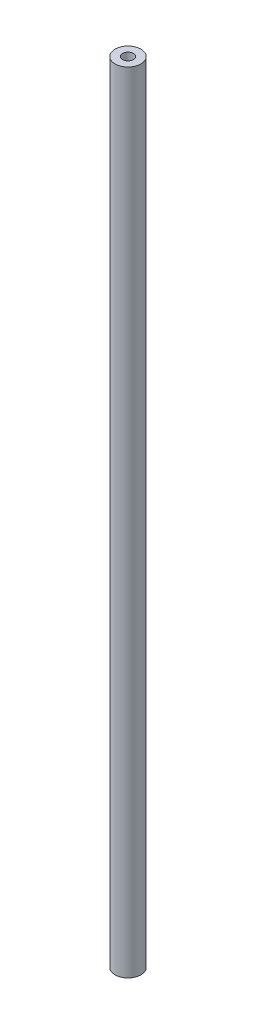
from build123d import *

# Parameters (mm, degrees)
SZKIC1_R                    = 5
DODANIE_WYCI_GNI_CIE1_DEPTH = 306
TAP_DRILL_FOR_M5_TAP1_D     = 4.2
TAP_DRILL_FOR_M5_TAP1_DEPTH = 30
TAP_DRILL_FOR_M5_TAP1_TIP   = 1.2618073
TAP_DRILL_FOR_M5_TAP2_D     = 4.2
TAP_DRILL_FOR_M5_TAP2_DEPTH = 30
TAP_DRILL_FOR_M5_TAP2_TIP   = 1.2618073


with BuildPart() as part:
    # Szkic1 → Dodanie-wyciągnięcie1 (new body)
    with BuildSketch(Plane(origin=(0, 0, 0), x_dir=(1, 0, 0), z_dir=(0, 1, 0))):
        Circle(SZKIC1_R)
    extrude(amount=DODANIE_WYCI_GNI_CIE1_DEPTH)

    # Tap Drill for M5 Tap1
    with Locations(Plane(origin=(0, 0, 0), x_dir=(-1, 0, 0), z_dir=(0, -1, 0))):
        with Locations((0, 0)):
            Hole(TAP_DRILL_FOR_M5_TAP1_D / 2, depth=TAP_DRILL_FOR_M5_TAP1_DEPTH)
            with Locations((0, 0, -(TAP_DRILL_FOR_M5_TAP1_DEPTH + TAP_DRILL_FOR_M5_TAP1_TIP / 2))):  # 118° drill point
                Cone(0, TAP_DRILL_FOR_M5_TAP1_D / 2, TAP_DRILL_FOR_M5_TAP1_TIP, mode=Mode.SUBTRACT)

    # Tap Drill for M5 Tap2
    with Locations(Plane(origin=(0, 306, 0), x_dir=(1, 0, 0), z_dir=(0, 1, 0))):
        with Locations((0, 0)):
            Hole(TAP_DRILL_FOR_M5_TAP2_D / 2, depth=TAP_DRILL_FOR_M5_TAP2_DEPTH)
            with Locations((0, 0, -(TAP_DRILL_FOR_M5_TAP2_DEPTH + TAP_DRILL_FOR_M5_TAP2_TIP / 2))):  # 118° drill point
                Cone(0, TAP_DRILL_FOR_M5_TAP2_D / 2, TAP_DRILL_FOR_M5_TAP2_TIP, mode=Mode.SUBTRACT)


solid = part.part
